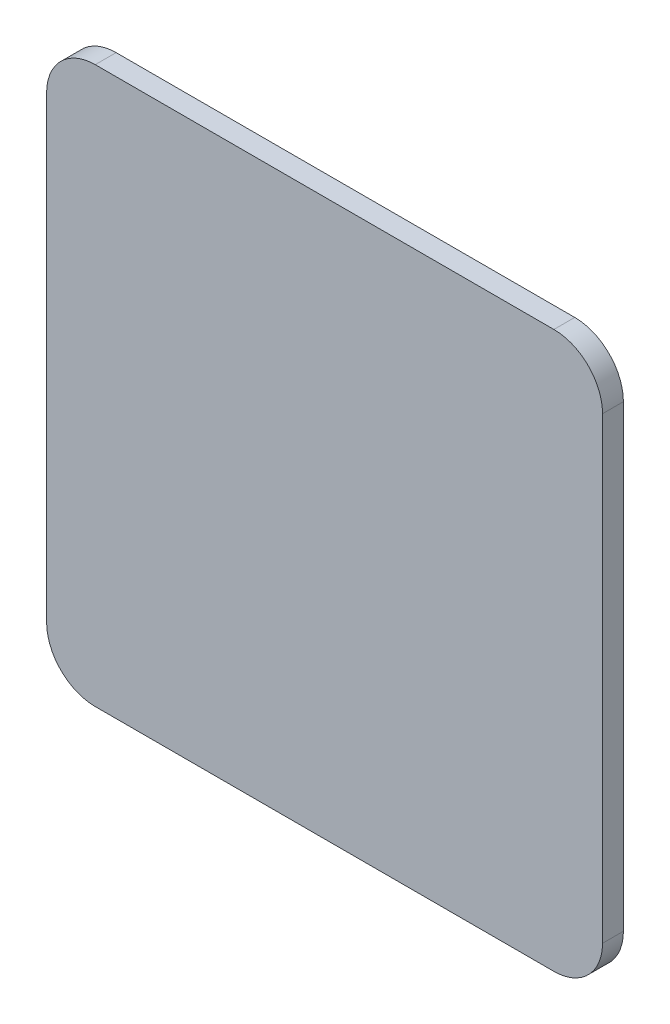
from build123d import *

# Parameters (mm, degrees)
SKETCH1_W           = 80
SKETCH1_H           = 80
BOSS_EXTRUDE1_DEPTH = 3
FILLET1_R           = 7


with BuildPart() as part:
    # Sketch1 → Boss-Extrude1 (new body)
    with BuildSketch(Plane.XY):
        Rectangle(SKETCH1_W, SKETCH1_H)
    extrude(amount=BOSS_EXTRUDE1_DEPTH)

    # Fillet1
    fillet1_edges = [part.edges().sort_by_distance(p)[0] for p in [
        (-40, 40, 1.5),
        (-40, -40, 1.5),
        (40, -40, 1.5),
        (40, 40, 1.5),
    ]]
    fillet(fillet1_edges, radius=FILLET1_R)


solid = part.part
